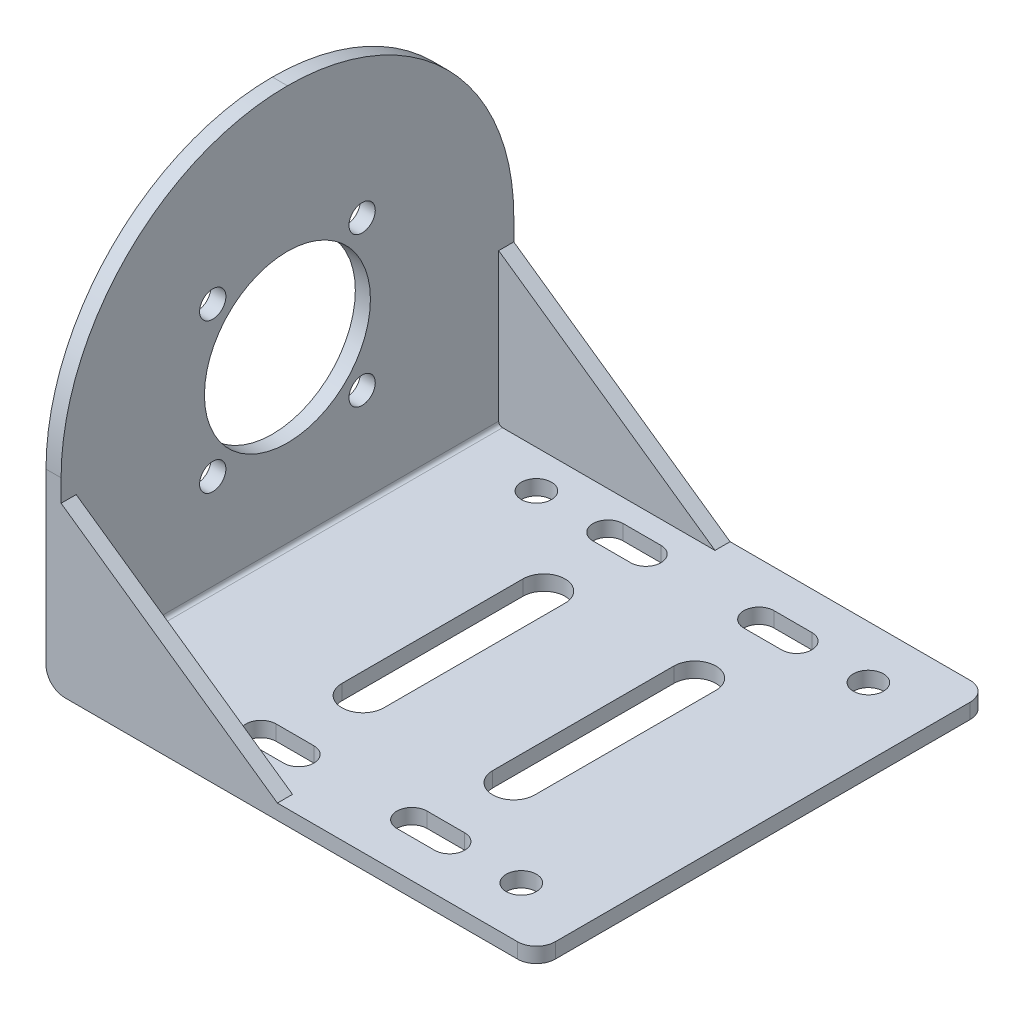
from build123d import *

# Parameters (mm, degrees)
BOSS_EXTRUDE1_DEPTH = 60
FILLET2_R           = 2.5
FILLET3_R           = 2.5
FILLET4_R           = 30
FILLET5_R           = 30
SKETCH3_R           = 11
SKETCH3_R_2         = 1.742420083
CUT_EXTRUDE1_DEPTH  = 5
BOSS_EXTRUDE3_START = -2
BOSS_EXTRUDE3_DEPTH = 2
BOSS_EXTRUDE4_DEPTH = 2
SKETCH7_R           = 2
CUT_EXTRUDE2_DEPTH  = 2


with BuildPart() as part:
    # Sketch2 → Boss-Extrude1 (new body)
    with BuildSketch(Plane.XY):
        with BuildLine():
            Line((0.5, 0), (63, 0))
            Line((63, 0), (63, -2))
            Line((63, -2), (0.5, -2))
            ThreePointArc((0.5, -2), (-1.267766953, -1.267766953), (-2, 0.5))
            Line((-2, 0.5), (-2, 53))
            Line((-2, 53), (0, 53))
            Line((0, 53), (0, 0.5))
            ThreePointArc((0, 0.5), (0.146446609, 0.146446609), (0.5, 0))
        make_face()
    extrude(amount=BOSS_EXTRUDE1_DEPTH)

    # Fillet2
    fillet2_edges = [part.edges().sort_by_distance(p)[0] for p in [
        (63, -1, 60),
    ]]
    fillet(fillet2_edges, radius=FILLET2_R)

    # Fillet3
    fillet3_edges = [part.edges().sort_by_distance(p)[0] for p in [
        (63, -1, 0),
    ]]
    fillet(fillet3_edges, radius=FILLET3_R)

    # Fillet4
    fillet4_edges = [part.edges().sort_by_distance(p)[0] for p in [
        (-1, 53, 60),
    ]]
    fillet(fillet4_edges, radius=FILLET4_R)

    # Fillet5
    fillet5_edges = [part.edges().sort_by_distance(p)[0] for p in [
        (-1, 53, 0),
    ]]
    fillet(fillet5_edges, radius=FILLET5_R - 0.0001)  # a hair under: the kernel refuses the full size

    # Sketch3 → Cut-Extrude1 (cut)
    with BuildSketch(Plane(origin=(0, 0, 0), x_dir=(0, 0, -1), z_dir=(1, 0, 0))):
        with Locations(Location((-30, 23, 0), (0, 0, 90))):
            Circle(SKETCH3_R)
        with Locations(Location((-39.899494937, 13.100505063, 0), (0, 0, 90))):
            Circle(SKETCH3_R_2)
        with Locations(Location((-39.899494937, 32.899494937, 0), (0, 0, 90))):
            Circle(SKETCH3_R_2)
        with Locations(Location((-20.100505063, 32.899494937, 0), (0, 0, 90))):
            Circle(SKETCH3_R_2)
        with Locations(Location((-20.100505063, 13.100505063, 0), (0, 0, 90))):
            Circle(SKETCH3_R_2)
    extrude(amount=-CUT_EXTRUDE1_DEPTH, mode=Mode.SUBTRACT)

    # Sketch4 → Boss-Extrude3 (add)
    with BuildSketch(Plane.XY.offset(60).offset(BOSS_EXTRUDE3_START)):
        with BuildLine():
            Line((0, 20.075175272), (28.67032155, 0))
            Line((28.67032155, 0), (0.5, 0))
            ThreePointArc((0.5, 0), (0.146446609, 0.146446609), (0, 0.5))
            Line((0, 0.5), (0, 20.075175272))
        make_face()
    extrude(amount=BOSS_EXTRUDE3_DEPTH)

    # Sketch6 → Boss-Extrude4 (add)
    with BuildSketch(Plane(origin=(0, 0, 0), x_dir=(-1, 0, 0), z_dir=(0, 0, -1))):
        with BuildLine():
            Line((0, 0.5), (0, 20.075175272))
            Line((0, 20.075175272), (-28.67032155, 0))
            Line((-28.67032155, 0), (-0.5, 0))
            ThreePointArc((-0.5, 0), (-0.146446609, 0.146446609), (0, 0.5))
        make_face()
    extrude(amount=-BOSS_EXTRUDE4_DEPTH)

    # Sketch7 → Cut-Extrude2 (cut)
    with BuildSketch(Plane(origin=(0, 0, 0), x_dir=(1, 0, 0), z_dir=(0, 1, 0))):
        with Locations(Location((54, -53, 0), (0, 0, 270))):
            Circle(SKETCH7_R)
        with Locations(Location((54, -7, 0), (0, 0, 270))):
            Circle(SKETCH7_R)
        with Locations(Location((10, -7, 0), (0, 0, 270))):
            Circle(SKETCH7_R)
        with Locations(Location((10, -53, 0), (0, 0, 270))):
            Circle(SKETCH7_R)
        with BuildLine():
            Line((44.5, -55), (39.5, -55))
            ThreePointArc((39.5, -55), (37.5, -53), (39.5, -51))
            Line((39.5, -51), (44.5, -51))
            ThreePointArc((44.5, -51), (46.5, -53), (44.5, -55))
        make_face()
        with BuildLine():
            Line((44.5, -9), (39.5, -9))
            ThreePointArc((39.5, -9), (37.5, -7), (39.5, -5))
            Line((39.5, -5), (44.5, -5))
            ThreePointArc((44.5, -5), (46.5, -7), (44.5, -9))
        make_face()
        with BuildLine():
            Line((24.5, -9), (19.5, -9))
            ThreePointArc((19.5, -9), (17.5, -7), (19.5, -5))
            Line((19.5, -5), (24.5, -5))
            ThreePointArc((24.5, -5), (26.5, -7), (24.5, -9))
        make_face()
        with BuildLine():
            Line((24.5, -55), (19.5, -55))
            ThreePointArc((19.5, -55), (17.5, -53), (19.5, -51))
            Line((19.5, -51), (24.5, -51))
            ThreePointArc((24.5, -51), (26.5, -53), (24.5, -55))
        make_face()
        with BuildLine():
            Line((24.79106514, -18), (24.79106514, -42))
            ThreePointArc((24.79106514, -42), (22, -44.79106514), (19.20893486, -42))
            Line((19.20893486, -42), (19.20893486, -18))
            ThreePointArc((19.20893486, -18), (22, -15.20893486), (24.79106514, -18))
        make_face()
        with BuildLine():
            Line((44.79106514, -18), (44.79106514, -42))
            ThreePointArc((44.79106514, -42), (42, -44.79106514), (39.20893486, -42))
            Line((39.20893486, -42), (39.20893486, -18))
            ThreePointArc((39.20893486, -18), (42, -15.20893486), (44.79106514, -18))
        make_face()
    extrude(amount=-CUT_EXTRUDE2_DEPTH, mode=Mode.SUBTRACT)


solid = part.part
